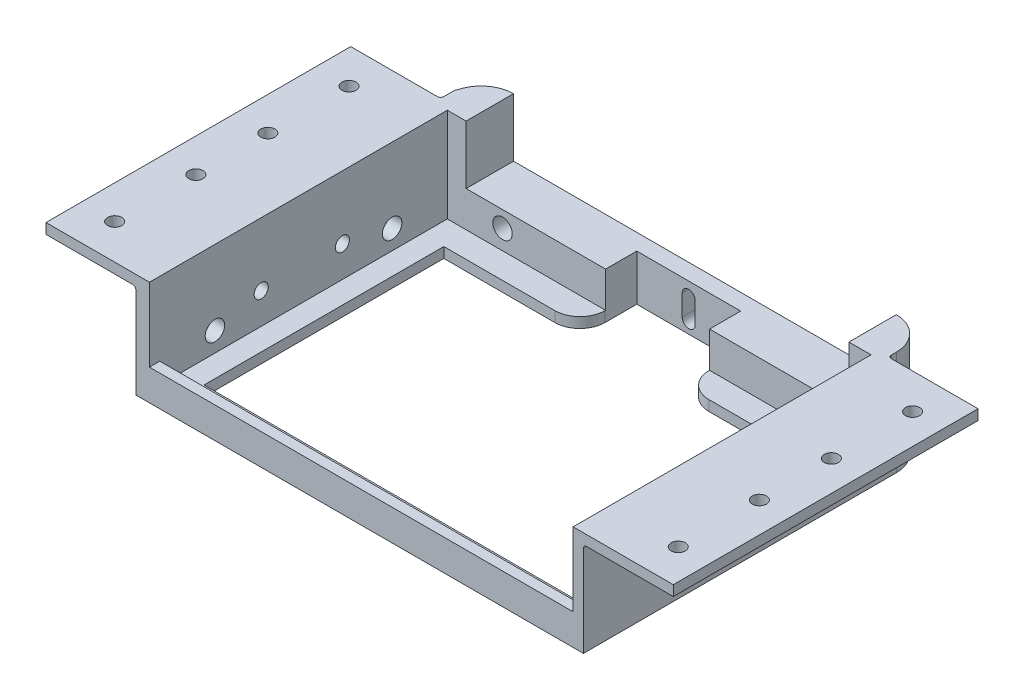
from build123d import *
from OCP.BRepAlgoAPI import BRepAlgoAPI_Cut
from OCP.TopTools import TopTools_ListOfShape

# Parameters (mm, degrees)
SKETCH1_W               = 193.19
SKETCH1_H               = 93.85
BOSS_EXTRUDE1_DEPTH     = 32.179999902
SKETCH3_W               = 93.85
SKETCH3_H               = 28.999999912
CUT_EXTRUDE1_DEPTH      = 27.67
SKETCH5_W               = 137.85
SKETCH5_H               = 32.179999902
BOSS_EXTRUDE2_DEPTH     = 12.5
SKETCH6_W               = 32
SKETCH6_H               = 40
CUT_EXTRUDE2_DEPTH      = 118.887561022
SKETCH21_W              = 116.85
SKETCH21_H              = 73.85
CUT_EXTRUDE3_DEPTH      = 118.887561022
CUT_EXTRUDE5_DEPTH      = 118.887561022
CUT_EXTRUDE5_DEPTH_BACK = 29
SKETCH22_W              = 130.49
SKETCH22_H              = 91.75
SKETCH23_W              = 130.49
SKETCH23_H              = 3.18
BOSS_EXTRUDE4_DEPTH     = 6.35
SKETCH25_R              = 2.185
CUT_EXTRUDE6_DEPTH      = 118.887561022
SKETCH26_R              = 2.185
CUT_EXTRUDE8_DEPTH      = 179.78409722
FILLET3_R               = 1
FILLET1_R               = 7.75
FILLET2_R               = 10
CUT_EXTRUDE9_REACH      = 149.229
SKETCH47_R              = 3.5
BOSS_EXTRUDE5_DEPTH     = 8
SKETCH48_R              = 3
CUT_EXTRUDE18_DEPTH     = 6
SKETCH49_R              = 3
CUT_EXTRUDE19_DEPTH     = 5
SKETCH51_R              = 3.5
BOSS_EXTRUDE6_DEPTH     = 8
SKETCH52_R              = 3
CUT_EXTRUDE21_DEPTH     = 5
SKETCH53_W              = 25.1
SKETCH53_H              = 21.647882291
SKETCH53_W_2            = 16.257833485
BOSS_EXTRUDE7_DEPTH     = 3.82
FILLET4_DEPTH           = 21.647882291
FILLET4_START           = -51.344578607
FILLET4_2_DEPTH         = 27.019578607
FILLET4_START_2         = 23.245
FILLET4_3_DEPTH         = 20.253781432
FILLET4_START_3         = 21.647882291
FILLET4_4_DEPTH         = 3.995947947
FILLET4_5_DEPTH         = 10.532117611
SKETCH54_W              = 36.508182433
SKETCH54_H              = 14.6
CUT_EXTRUDE24_DEPTH     = 22.649999902
SKETCH55_W              = 81.374829932
SKETCH55_H              = 14.6
CUT_EXTRUDE26_DEPTH     = 18
SKETCH57_W              = 36.508182433
SKETCH57_H              = 14.6
BOSS_EXTRUDE8_DEPTH     = 4.649999902


with BuildPart() as part:
    # Sketch1 → Boss-Extrude1 (new body)
    with BuildSketch(Plane(origin=(0, 0, 0), x_dir=(1, 0, 0), z_dir=(0, 1, 0))):
        Rectangle(SKETCH1_W, SKETCH1_H)
    extrude(amount=BOSS_EXTRUDE1_DEPTH)

    # Sketch3 → Cut-Extrude1 (cut)
    with BuildSketch(Plane.ZY.offset(96.595)):
        with Locations((0, 14.499999956)):
            Rectangle(SKETCH3_W, SKETCH3_H)
    cut_extrude1 = extrude(amount=-CUT_EXTRUDE1_DEPTH, mode=Mode.SUBTRACT)

    # Mirror1: Cut-Extrude1 across plane
    add(cut_extrude1.mirror(Plane(origin=(0, 0, 0), x_dir=(0, 0, 1), z_dir=(1, 0, 0))), mode=Mode.SUBTRACT)

    # Sketch5 → Boss-Extrude2 (add)
    with BuildSketch(Plane(origin=(0, 0, -46.925), x_dir=(-1, 0, 0), z_dir=(0, 0, -1))):
        with Locations((0, 16.089999951)):
            Rectangle(SKETCH5_W, SKETCH5_H)
    extrude(amount=BOSS_EXTRUDE2_DEPTH)

    # Sketch6 → Cut-Extrude2 (cut, through all)
    with BuildSketch(Plane(origin=(0, 32.179999902, 0), x_dir=(1, 0, 0), z_dir=(0, 1, 0))):
        with Locations((0, 34.425)):
            Rectangle(SKETCH6_W, SKETCH6_H)
    extrude(amount=-CUT_EXTRUDE2_DEPTH, mode=Mode.SUBTRACT)

    # Sketch21 → Cut-Extrude3 (cut, through all)
    with BuildSketch(Plane(origin=(0, 32.179999902, 0), x_dir=(1, 0, 0), z_dir=(0, 1, 0))):
        with Locations((0.5, 0)):
            Rectangle(SKETCH21_W, SKETCH21_H)
    extrude(amount=-CUT_EXTRUDE3_DEPTH, mode=Mode.SUBTRACT)

    # Sketch22 → Cut-Extrude5 (cut, two sides: drawn at the far end of the back side and taken through both)
    with BuildSketch(Plane(origin=(0, 32.179999902, 0), x_dir=(1, 0, 0), z_dir=(0, 1, 0)).offset(-CUT_EXTRUDE5_DEPTH_BACK)):
        with Locations((0.5, -1.05)):
            Rectangle(SKETCH22_W, SKETCH22_H)
    extrude(amount=CUT_EXTRUDE5_DEPTH + CUT_EXTRUDE5_DEPTH_BACK, mode=Mode.SUBTRACT)

    # Sketch23 → Boss-Extrude4 (add)
    with BuildSketch(Plane(origin=(0, 3.18, 0), x_dir=(1, 0, 0), z_dir=(0, 1, 0))):
        with Locations((0.5, -45.335)):
            Rectangle(SKETCH23_W, SKETCH23_H)
    extrude(amount=BOSS_EXTRUDE4_DEPTH)

    # Sketch25 → Cut-Extrude6 (cut, through all)
    with BuildSketch(Plane(origin=(0, 32.179999902, 0), x_dir=(1, 0, 0), z_dir=(0, 1, 0))):
        with Locations(Location((-86.285, 36.085, 0), (0, 0, 270))):
            Circle(SKETCH25_R)
        with Locations(Location((-86.285, 11.085, 0), (0, 0, 270))):
            Circle(SKETCH25_R)
        with Locations(Location((-86.285, -11.085, 0), (0, 0, 270))):
            Circle(SKETCH25_R)
        with Locations(Location((-86.285, -36.085, 0), (0, 0, 270))):
            Circle(SKETCH25_R)
    cut_extrude6 = extrude(amount=-CUT_EXTRUDE6_DEPTH, mode=Mode.SUBTRACT)

    # Sketch26 → Cut-Extrude8 (cut, through all)
    with BuildSketch(Plane.ZY.offset(68.925)):
        with Locations((-12.505, 12.7)):
            Circle(SKETCH26_R)
        with Locations((12.495, 12.7)):
            Circle(SKETCH26_R)
    extrude(amount=-CUT_EXTRUDE8_DEPTH, mode=Mode.SUBTRACT)

    # Mirror4: Cut-Extrude6 across plane
    add(cut_extrude6.mirror(Plane(origin=(0.5, 0, 0), x_dir=(0, 0, 1), z_dir=(1, 0, 0))), mode=Mode.SUBTRACT)

    # Fillet3
    fillet3_edges = [part.edges().sort_by_distance(p)[0] for p in [
        (-68.925, 28.999999912, 0),
        (68.925, 28.999999912, 0),
        (-68.925, 30.589999907, -46.925),
        (68.925, 30.589999907, -46.925),
    ]]
    fillet(fillet3_edges, radius=FILLET3_R)

    # Fillet1
    fillet1_edges = [part.edges().sort_by_distance(p)[0] for p in [
        (-16, 1.589999951, -36.925),
        (16, 1.589999951, -36.925),
    ]]
    fillet(fillet1_edges, radius=FILLET1_R)

    # Fillet2
    fillet2_edges = [part.edges().sort_by_distance(p)[0] for p in [
        (68.925, 16.089999951, -59.425),
        (-68.925, 16.089999951, -59.425),
    ]]
    fillet(fillet2_edges, radius=FILLET2_R)

    # Sketch27 → Cut-Extrude9 (cut, up to next)
    with BuildSketch(Plane(origin=(0, 0, -59.425), x_dir=(-1, 0, 0), z_dir=(0, 0, -1)), mode=Mode.PRIVATE) as cut_extrude9_sk1:
        with BuildLine():
            Line((-2, 3.5), (-2, 10))
            ThreePointArc((-2, 10), (0, 12), (2, 10))
            Line((2, 10), (2, 3.5))
            ThreePointArc((2, 3.5), (0, 1.5), (-2, 3.5))
        make_face()
    cut_extrude9_tool1 = extrude(cut_extrude9_sk1.sketch, amount=-CUT_EXTRUDE9_REACH, mode=Mode.PRIVATE) & part.part
    add(cut_extrude9_tool1.solids().sort_by_distance((0, 6.75, -59.425))[0], mode=Mode.SUBTRACT)

    # Sketch47 → Boss-Extrude5 (add)
    with BuildSketch(Plane(origin=(-64.745, 0, 0), x_dir=(0, 0, -1), z_dir=(1, 0, 0))):
        with Locations((27.825, 9.18)):
            Circle(SKETCH47_R)
    extrude(amount=-BOSS_EXTRUDE5_DEPTH)

    # Sketch48 → Cut-Extrude18 (cut)
    with BuildSketch(Plane(origin=(-64.745, 0, 0), x_dir=(0, 0, -1), z_dir=(1, 0, 0))):
        with Locations((27.825, 9.18)):
            Circle(SKETCH48_R)
    extrude(amount=-CUT_EXTRUDE18_DEPTH, mode=Mode.SUBTRACT)

    # Sketch49 → Cut-Extrude19 (cut)
    with BuildSketch(Plane.XY.offset(-44.825)):
        with Locations((-47.745, 9.18)):
            Circle(SKETCH49_R)
    extrude(amount=-CUT_EXTRUDE19_DEPTH, mode=Mode.SUBTRACT)

    # Sketch51 → Boss-Extrude6 (add)
    with BuildSketch(Plane(origin=(-64.745, 0, 0), x_dir=(0, 0, -1), z_dir=(1, 0, 0))):
        with Locations((-26.745, 9.18)):
            Circle(SKETCH51_R)
    extrude(amount=-BOSS_EXTRUDE6_DEPTH)

    # Sketch52 → Cut-Extrude21 (cut)
    with BuildSketch(Plane(origin=(-64.745, 0, 0), x_dir=(0, 0, -1), z_dir=(1, 0, 0))):
        with Locations((-26.745, 9.18)):
            Circle(SKETCH52_R)
    extrude(amount=-CUT_EXTRUDE21_DEPTH, mode=Mode.SUBTRACT)

    # Sketch53 → Boss-Extrude7 (add)
    with BuildSketch(Plane.ZY.offset(68.925)):
        with Locations((-36.875, 10.823941146)):
            Rectangle(SKETCH53_W, SKETCH53_H)
        with Locations((31.373916743, 10.823941146)):
            Rectangle(SKETCH53_W_2, SKETCH53_H)
    extrude(amount=BOSS_EXTRUDE7_DEPTH)


with BuildPart() as fillet4_tool:
    # Fillet4: read off the stored shape, not the designer's step
    # Fillet4 outline → Fillet4 (new body)
    with BuildSketch(Plane(origin=(0, 0, 0), x_dir=(1, 0, 0), z_dir=(0, 1, 0))):
        with BuildLine():
            Line((-68.925, -39.502833485), (-72.745, -39.502833485))
            ThreePointArc((-72.745, -39.502833485), (-70.033633541, -40.73472644), (-68.925, -43.498781432))
            Line((-68.925, -43.498781432), (-68.925, -39.502833485))
        make_face()
        with BuildLine():
            Line((-72.341407865, 49.425), (-68.925, 49.425))
            ThreePointArc((-68.925, 49.425), (-68.820238369, 50.868695821), (-68.508148475, 52.282142857))
            ThreePointArc((-68.508148475, 52.282142857), (-69.950950646, 50.217865097), (-72.341407865, 49.425))
        make_face()
    extrude(amount=FILLET4_DEPTH)


with BuildPart() as part_1:
    add(part.part)


with BuildPart() as part_2:
    # Fillet4: joined with fillet4_tool
    add(part_1.part.fuse(fillet4_tool.part, tol=0.00001))


with BuildPart() as fillet4_2_tool:
    # Fillet4 2 outline → Fillet4 2 (new body)
    with BuildSketch(Plane.XY.offset(FILLET4_START)):
        with BuildLine():
            ThreePointArc((-68.925, 25.643830238), (-70.033633541, 22.879775246), (-72.745, 21.647882291))
            Line((-72.745, 21.647882291), (-68.925, 21.647882291))
            Line((-68.925, 21.647882291), (-68.925, 25.643830238))
        make_face()
    extrude(amount=FILLET4_2_DEPTH)


with BuildPart() as part_3:
    add(part_2.part)


with BuildPart() as part_4:
    # Fillet4 2: joined with fillet4_2_tool
    add(part_3.part.fuse(fillet4_2_tool.part, tol=0.00001))


with BuildPart() as fillet4_3_tool:
    # Fillet4 3 outline → Fillet4 3 (new body)
    with BuildSketch(Plane.XY.offset(FILLET4_START_2)):
        with BuildLine():
            ThreePointArc((-68.925, 25.643830238), (-70.033633541, 22.879775246), (-72.745, 21.647882291))
            Line((-72.745, 21.647882291), (-68.925, 21.647882291))
            Line((-68.925, 21.647882291), (-68.925, 25.643830238))
        make_face()
    extrude(amount=FILLET4_3_DEPTH)


with BuildPart() as part_5:
    add(part_4.part)


with BuildPart() as part_6:
    # Fillet4 3: joined with fillet4_3_tool
    add(part_5.part.fuse(fillet4_3_tool.part, tol=0.00001))


with BuildPart() as fillet4_4_tool:
    # Fillet4 4 outline → Fillet4 4 (new body)
    with BuildSketch(Plane(origin=(0, 0, 0), x_dir=(1, 0, 0), z_dir=(0, 1, 0)).offset(FILLET4_START_3)):
        with BuildLine():
            ThreePointArc((-68.925, -43.498781432), (-70.033633541, -40.73472644), (-72.745, -39.502833485))
            Line((-72.745, -39.502833485), (-72.745, -43.498781432))
            Line((-72.745, -43.498781432), (-68.925, -43.498781432))
        make_face()
        with BuildLine():
            Line((-68.925, 51.344577615), (-72.745, 51.344578607))
            Line((-72.745, 51.344578607), (-72.745, 49.425))
            Line((-72.745, 49.425), (-72.341407865, 49.425))
            ThreePointArc((-72.341407865, 49.425), (-70.38203163, 49.93775972), (-68.925, 51.344577615))
        make_face()
    extrude(amount=FILLET4_4_DEPTH)


with BuildPart() as part_7:
    add(part_6.part)

    # Fillet4 4: cut by fillet4_4_tool, with a tolerance
    fillet4_4_stock = TopTools_ListOfShape()
    fillet4_4_stock.Append(part_7.part.wrapped)
    fillet4_4_tools = TopTools_ListOfShape()
    fillet4_4_tools.Append(fillet4_4_tool.part.wrapped)
    fillet4_4_cut = BRepAlgoAPI_Cut()
    fillet4_4_cut.SetArguments(fillet4_4_stock)
    fillet4_4_cut.SetTools(fillet4_4_tools)
    fillet4_4_cut.SetFuzzyValue(0.00001)
    fillet4_4_cut.Build()
    add(Compound.cast(fillet4_4_cut.Shape()).solids(), mode=Mode.REPLACE)


with BuildPart() as fillet4_5_tool:
    # Fillet4 5 outline → Fillet4 5 (new body)
    with BuildSketch(Plane(origin=(0, 0, 0), x_dir=(1, 0, 0), z_dir=(0, 1, 0)).offset(FILLET4_START_3)):
        with BuildLine():
            ThreePointArc((-68.508148475, 52.282142857), (-68.686387212, 51.799938762), (-68.925, 51.344577615))
            Line((-68.925, 51.344577615), (-68.925, 49.425))
            ThreePointArc((-68.925, 49.425), (-68.820238369, 50.868695821), (-68.508148475, 52.282142857))
        make_face()
    extrude(amount=FILLET4_5_DEPTH)


with BuildPart() as part_8:
    add(part_7.part)


with BuildPart() as part_9:
    # Fillet4 5: joined with fillet4_5_tool
    add(part_8.part.fuse(fillet4_5_tool.part, tol=0.00001))

    # Sketch54 → Cut-Extrude24 (cut)
    with BuildSketch(Plane(origin=(0, 32.179999902, 0), x_dir=(1, 0, 0), z_dir=(0, 1, 0))):
        with Locations((40.670908784, 52.125)):
            Rectangle(SKETCH54_W, SKETCH54_H)
    extrude(amount=-CUT_EXTRUDE24_DEPTH, mode=Mode.SUBTRACT)

    # Sketch55 → Cut-Extrude26 (cut)
    with BuildSketch(Plane(origin=(0, 32.179999902, 0), x_dir=(1, 0, 0), z_dir=(0, 1, 0))):
        with Locations((-18.270597399, 52.125)):
            Rectangle(SKETCH55_W, SKETCH55_H)
    extrude(amount=-CUT_EXTRUDE26_DEPTH, mode=Mode.SUBTRACT)

    # Sketch57 → Boss-Extrude8 (add)
    with BuildSketch(Plane(origin=(0, 9.53, 0), x_dir=(1, 0, 0), z_dir=(0, 1, 0))):
        with Locations((40.670908784, 52.125)):
            Rectangle(SKETCH57_W, SKETCH57_H)
    extrude(amount=BOSS_EXTRUDE8_DEPTH)


solid = part_9.part
